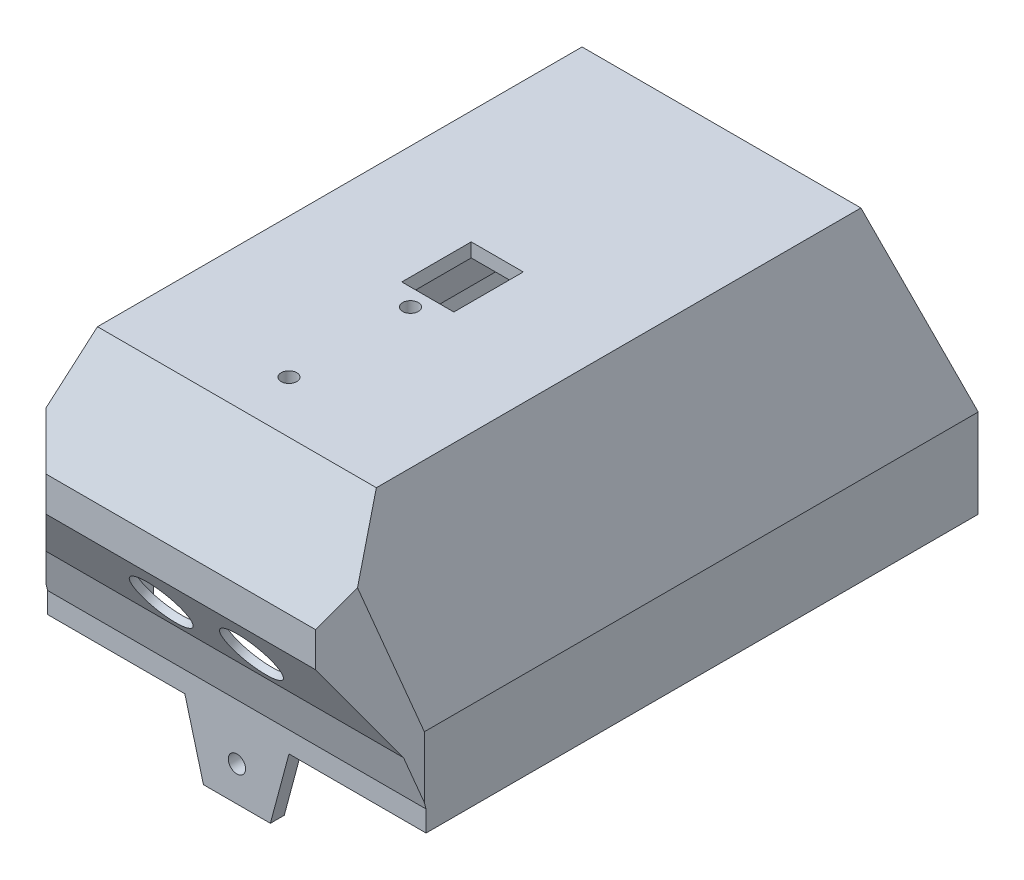
from build123d import *
from OCP.BRepFilletAPI import BRepFilletAPI_MakeChamfer

# Parameters (mm, degrees)
SKETCH1_W                                    = 101
SKETCH1_H                                    = 151
BOX_DEPTH                                    = 75
CHAMFER_SIDES_SIZE                           = 50
CHAMFER_SIDES_SIZE2                          = 13.397459622
CHAMFER_BACK_SIZE                            = 50
CHAMFER_BACK_SIZE2                           = 18.198511713
SHELL1_T                                     = 4
SKETCH2_W                                    = 30
SKETCH2_H                                    = 20
SKETCH2_R                                    = 2.5
FRONT_MOUNT_TAB_DEPTH                        = 4
BACK_START                                   = -4
SKETCH3_W                                    = 30
SKETCH3_H                                    = 20
SKETCH3_R                                    = 2.5
BACK_MOUNT_TAB_DEPTH                         = 4
CHAMFER_MOUNT_TAB_SIZE                       = 20
CHAMFER_MOUNT_TAB_SIZE_2                     = 5.358983849
HEAD_ASSEMBLY_MOUNT_AND_CABLE_PASSTHRU_REACH = 140.172
SKETCH4_R                                    = 2.25
SKETCH4_W                                    = 15
SKETCH4_H                                    = 20
STAIR_DETECTION_MOUNT_DEPTH                  = 30
SHELL_START                                  = -28
SHELL_MOUNT_DEPTH                            = 56
SKETCH7_W                                    = 56
SKETCH7_H                                    = 62
OPEN_SHELL_TO_SHELL_DEPTH                    = 4
FILL_GAP_REACH                               = 187.721
SKETCH9_W                                    = 56
SKETCH9_H                                    = 2
STAIR_DETECTION_EYE_HOLES_REACH              = 183.466
SKETCH8_R                                    = 8.25
CHAMFER_FRONT_1_SIZE                         = 25
CHAMFER_FRONT_2_SIZE                         = 7
POWER_SWITCH_AND_USB_ACCESS_REACH            = 201.736
SKETCH10_W                                   = 25
SKETCH10_H                                   = 15


# Read off the part's stored shape, not the designer's step: shell mount
# Some blends are built 0.0001 mm under size
with BuildPart() as part:
    # Sketch1 → box (new body)
    with BuildSketch(Plane(origin=(0, 0, 0), x_dir=(1, 0, 0), z_dir=(0, 1, 0))):
        Rectangle(SKETCH1_W, SKETCH1_H)
    extrude(amount=BOX_DEPTH)

    # Chamfer sides: one chamfer whose edges measure the first distance from different faces: ONE call of the kernel's chamfer builder (chamfer() names one face for all edges)
    chamfer_sides_edges_1 = [part.edges().sort_by_distance(p)[0] for p in [
        (-50.5, 75, 0),
    ]]
    chamfer_sides_side_1 = [part.faces().sort_by_distance(p)[0] for p in [
        (-50.5, 37.5, 0),
    ]]
    chamfer_sides_edges_2 = [part.edges().sort_by_distance(p)[0] for p in [
        (50.5, 75, 0),
    ]]
    chamfer_sides_side_2 = [part.faces().sort_by_distance(p)[0] for p in [
        (50.5, 37.5, 0),
    ]]
    chamfer_sides = BRepFilletAPI_MakeChamfer(part.part.solid().wrapped)
    for e in chamfer_sides_edges_1:
        chamfer_sides.Add(CHAMFER_SIDES_SIZE, CHAMFER_SIDES_SIZE2, e.wrapped, chamfer_sides_side_1[0].wrapped)  # the first distance lies on this face
    for e in chamfer_sides_edges_2:
        chamfer_sides.Add(CHAMFER_SIDES_SIZE, CHAMFER_SIDES_SIZE2, e.wrapped, chamfer_sides_side_2[0].wrapped)  # the first distance lies on this face
    add(Compound.cast(chamfer_sides.Shape()), mode=Mode.REPLACE)

    # Chamfer back
    chamfer_back_edges = [part.edges().sort_by_distance(p)[0] for p in [
        (0, 75, -75.5),
    ]]
    chamfer_back_side = [part.faces().sort_by_distance(p)[0] for p in [
        (0, 35.478938394, -75.5),
    ]]
    chamfer(chamfer_back_edges, length=CHAMFER_BACK_SIZE, length2=CHAMFER_BACK_SIZE2, reference=chamfer_back_side[0])

    # Shell1
    shell1_openings = [part.faces().sort_by_distance(p)[0] for p in [
        (0, 0, 0),
    ]]
    offset(amount=SHELL1_T, openings=shell1_openings, kind=Kind.INTERSECTION)

    # Sketch2 → front mount tab (add)
    with BuildSketch(Plane.XY.offset(79.5)):
        with Locations((0, -10)):
            Rectangle(SKETCH2_W, SKETCH2_H)
        with Locations((0, -10)):
            Circle(SKETCH2_R, mode=Mode.SUBTRACT)
    extrude(amount=-FRONT_MOUNT_TAB_DEPTH)

    # Sketch3 → back mount tab (add)
    with BuildSketch(Plane(origin=(0, 0, -79.5), x_dir=(-1, 0, 0), z_dir=(0, 0, -1)).offset(BACK_START)):
        with Locations((0, -10)):
            Rectangle(SKETCH3_W, SKETCH3_H)
        with Locations(Location((0, -10, 0), (0, 0, 180))):
            Circle(SKETCH3_R, mode=Mode.SUBTRACT)
    extrude(amount=BACK_MOUNT_TAB_DEPTH)

    # Chamfer mount tab
    chamfer_mount_tab_edges_1 = [part.edges().sort_by_distance(p)[0] for p in [
        (-15, -20, 77.5),
    ]]
    chamfer_mount_tab_side_1 = [part.faces().sort_by_distance(p)[0] for p in [
        (-15, -19.892820323, 77.5),
    ]]
    chamfer_mount_tab_edges_2 = [part.edges().sort_by_distance(p)[0] for p in [
        (15, -20, 77.5),
    ]]
    chamfer_mount_tab_side_2 = [part.faces().sort_by_distance(p)[0] for p in [
        (15, -19.892820323, 77.5),
    ]]
    chamfer_mount_tab_edges_3 = [part.edges().sort_by_distance(p)[0] for p in [
        (-15, -20, -77.5),
    ]]
    chamfer_mount_tab_side_3 = [part.faces().sort_by_distance(p)[0] for p in [
        (-15, -19.892820323, -77.5),
    ]]
    chamfer_mount_tab_edges_4 = [part.edges().sort_by_distance(p)[0] for p in [
        (15, -20, -77.5),
    ]]
    chamfer_mount_tab_side_4 = [part.faces().sort_by_distance(p)[0] for p in [
        (14.892820323, -20, -77.5),
    ]]
    chamfer_mount_tab = BRepFilletAPI_MakeChamfer(part.part.solid().wrapped)
    for e in chamfer_mount_tab_edges_1:
        chamfer_mount_tab.Add(CHAMFER_MOUNT_TAB_SIZE - 0.0001, CHAMFER_MOUNT_TAB_SIZE_2 - 0.0001, e.wrapped, chamfer_mount_tab_side_1[0].wrapped)
    for e in chamfer_mount_tab_edges_2:
        chamfer_mount_tab.Add(CHAMFER_MOUNT_TAB_SIZE - 0.0001, CHAMFER_MOUNT_TAB_SIZE_2 - 0.0001, e.wrapped, chamfer_mount_tab_side_2[0].wrapped)
    for e in chamfer_mount_tab_edges_3:
        chamfer_mount_tab.Add(CHAMFER_MOUNT_TAB_SIZE - 0.0001, CHAMFER_MOUNT_TAB_SIZE_2 - 0.0001, e.wrapped, chamfer_mount_tab_side_3[0].wrapped)
    for e in chamfer_mount_tab_edges_4:
        chamfer_mount_tab.Add(CHAMFER_MOUNT_TAB_SIZE_2 - 0.0001, CHAMFER_MOUNT_TAB_SIZE - 0.0001, e.wrapped, chamfer_mount_tab_side_4[0].wrapped)
    add(Compound.cast(chamfer_mount_tab.Shape()), mode=Mode.REPLACE)  # a hair under: the kernel refuses the full size

    # Sketch4 → head assembly mount and cable passthru (cut, up to next)
    with BuildSketch(Plane(origin=(0, 79, 0), x_dir=(1, 0, 0), z_dir=(0, 1, 0)), mode=Mode.PRIVATE) as head_assembly_mount_and_cable_passthru_sk1:
        with Locations(Location((0, -64.5, 0), (0, 0, 270))):
            Circle(SKETCH4_R)
    head_assembly_mount_and_cable_passthru_tool1 = extrude(head_assembly_mount_and_cable_passthru_sk1.sketch, amount=-HEAD_ASSEMBLY_MOUNT_AND_CABLE_PASSTHRU_REACH, mode=Mode.PRIVATE) & part.part
    # Sketch4 → head assembly mount and cable passthru (cut, up to next)
    with BuildSketch(Plane(origin=(0, 79, 0), x_dir=(1, 0, 0), z_dir=(0, 1, 0)), mode=Mode.PRIVATE) as head_assembly_mount_and_cable_passthru_sk2:
        with Locations(Location((0, -29.5, 0), (0, 0, 270))):
            Circle(SKETCH4_R)
    head_assembly_mount_and_cable_passthru_tool2 = extrude(head_assembly_mount_and_cable_passthru_sk2.sketch, amount=-HEAD_ASSEMBLY_MOUNT_AND_CABLE_PASSTHRU_REACH, mode=Mode.PRIVATE) & part.part
    # Sketch4 → head assembly mount and cable passthru (cut, up to next)
    with BuildSketch(Plane(origin=(0, 79, 0), x_dir=(1, 0, 0), z_dir=(0, 1, 0)), mode=Mode.PRIVATE) as head_assembly_mount_and_cable_passthru_sk3:
        with Locations((0, -14.5)):
            Rectangle(SKETCH4_W, SKETCH4_H)
    head_assembly_mount_and_cable_passthru_tool3 = extrude(head_assembly_mount_and_cable_passthru_sk3.sketch, amount=-HEAD_ASSEMBLY_MOUNT_AND_CABLE_PASSTHRU_REACH, mode=Mode.PRIVATE) & part.part
    add(head_assembly_mount_and_cable_passthru_tool1.solids().sort_by_distance((0, 79, 64.5))[0], mode=Mode.SUBTRACT)
    add(head_assembly_mount_and_cable_passthru_tool2.solids().sort_by_distance((0, 79, 29.5))[0], mode=Mode.SUBTRACT)
    add(head_assembly_mount_and_cable_passthru_tool3.solids().sort_by_distance((0, 79, 14.5))[0], mode=Mode.SUBTRACT)


with BuildPart() as body_2:
    # Sketch5 → stair detection mount (new, symmetric)
    with BuildSketch(Plane(origin=(0, 0, 0), x_dir=(0, 0, -1), z_dir=(1, 0, 0))):
        Polygon((-79.5, 13), (-95.665807537, 41), (-95.665807537, 51), (-79.5, 79), (-75.5, 79), (-75.5, 75), (-75.5, 25), (-75.5, 13), align=None)
    extrude(amount=STAIR_DETECTION_MOUNT_DEPTH, both=True)

    # shell mount outline → shell mount (cut)
    with BuildSketch(Plane.YZ.offset(SHELL_START)):
        Polygon((77, 75.5), (77, 78.345299462), (50.464101615, 93.665807537), (41.535898385, 93.665807537), (15, 78.345299462), (15, 75.5), align=None)
    extrude(amount=SHELL_MOUNT_DEPTH, mode=Mode.SUBTRACT)


with BuildPart() as open_shell_to_shell_tool:
    # Sketch7 → open shell to shell (new body)
    with BuildSketch(Plane.XY.offset(79.5)):
        with Locations((0, 46)):
            Rectangle(SKETCH7_W, SKETCH7_H)
    extrude(amount=-OPEN_SHELL_TO_SHELL_DEPTH)


with BuildPart() as part_1:
    add(part.part)

    # open shell to shell: cut by open_shell_to_shell_tool
    add(open_shell_to_shell_tool.part, mode=Mode.SUBTRACT)

    # Sketch9 → fill gap (add, up to next)
    with BuildSketch(Plane(origin=(0, 0, 79.5), x_dir=(-1, 0, 0), z_dir=(0, 0, -1)), mode=Mode.PRIVATE) as fill_gap_sk1:
        with Locations((0, 76)):
            Rectangle(SKETCH9_W, SKETCH9_H)
    fill_gap_tool1 = extrude(fill_gap_sk1.sketch, amount=FILL_GAP_REACH, mode=Mode.PRIVATE) - part_1.part
    add(fill_gap_tool1.solids().sort_by_distance((0, 76, 79.5))[0])


with BuildPart() as body_2_1:
    add(body_2.part)

    # open shell to shell: cut by open_shell_to_shell_tool
    add(open_shell_to_shell_tool.part, mode=Mode.SUBTRACT)


with BuildPart() as part_2:
    add(part_1.part)

    # Combine two shells: union body 2
    add(body_2_1.part)

    # Sketch8 → stair detection eye holes (cut, up to next)
    with BuildSketch(Plane(origin=(0, -31.1745098, 53.995834875), x_dir=(1, 0, 0), z_dir=(0, -0.4999999999999956, 0.8660254037844412)), mode=Mode.PRIVATE) as stair_detection_eye_holes_sk1:
        with Locations(Location((13, 68.628330249, 0), (0, 0, 270))):
            Circle(SKETCH8_R)
    stair_detection_eye_holes_tool1 = extrude(stair_detection_eye_holes_sk1.sketch, amount=-STAIR_DETECTION_EYE_HOLES_REACH, mode=Mode.PRIVATE) & part_2.part
    # Sketch8 → stair detection eye holes (cut, up to next)
    with BuildSketch(Plane(origin=(0, -31.1745098, 53.995834875), x_dir=(1, 0, 0), z_dir=(0, -0.4999999999999956, 0.8660254037844412)), mode=Mode.PRIVATE) as stair_detection_eye_holes_sk2:
        with Locations(Location((-13, 68.628330249, 0), (0, 0, 90))):
            Circle(SKETCH8_R)
    stair_detection_eye_holes_tool2 = extrude(stair_detection_eye_holes_sk2.sketch, amount=-STAIR_DETECTION_EYE_HOLES_REACH, mode=Mode.PRIVATE) & part_2.part
    add(stair_detection_eye_holes_tool1.solids().sort_by_distance((13, 28.259368, 88.31))[0], mode=Mode.SUBTRACT)
    add(stair_detection_eye_holes_tool2.solids().sort_by_distance((-13, 28.259368, 88.31))[0], mode=Mode.SUBTRACT)

    # Chamfer front 1
    # the kernel refuses this chamfer: 25 mm, written as the material it adds along each edge
    with BuildSketch(Plane(origin=(-30, 79, 79.5), x_dir=(-0.9996219169112966, 0, -0.027495876610586594), z_dir=(0, -1, 0))) as chamfer_front_1_piece_1_section:
        Polygon((CHAMFER_FRONT_1_SIZE * 0.999621916911, -CHAMFER_FRONT_1_SIZE * 0.0274958766106), (-CHAMFER_FRONT_1_SIZE * 0.0274958766106, -CHAMFER_FRONT_1_SIZE * 0.999621916911), (0, 0), align=None)
    chamfer_front_1_piece_1 = extrude(amount=130.292074699, mode=Mode.PRIVATE)
    chamfer_front_1_piece_1 = split(chamfer_front_1_piece_1, bisect_by=Plane(origin=(-54.5, 43.759151697, 84.684492494), z_dir=(1, 0, 0)), keep=Keep.TOP, mode=Mode.PRIVATE)
    chamfer_front_1_piece_1 = split(chamfer_front_1_piece_1, bisect_by=Plane(origin=(-48.880491022, 46.498903009, 84.684492494), z_dir=(0.9659258262890682, -0.25881904510252135, 0)), keep=Keep.TOP, mode=Mode.PRIVATE)
    chamfer_front_1_piece_1 = split(chamfer_front_1_piece_1, bisect_by=Plane(origin=(-38.655599925, 38.314314876, 94.115226508), z_dir=(0, 0.4999999999999953, -0.8660254037844416)), keep=Keep.TOP, mode=Mode.PRIVATE)
    chamfer_front_1_piece_1 = split(chamfer_front_1_piece_1, bisect_by=Plane(origin=(-38.655599925, 50.32441267, 96.055858064), z_dir=(0, -0.4999999999999949, -0.8660254037844416)), keep=Keep.TOP, mode=Mode.PRIVATE)
    chamfer_front_1_piece_1 = split(chamfer_front_1_piece_1, bisect_by=Plane(origin=(-38.655599925, 43.759151697, 95.665807537), z_dir=(0, 0, -1)), keep=Keep.TOP, mode=Mode.PRIVATE)
    add(chamfer_front_1_piece_1)
    with BuildSketch(Plane(origin=(30, 79, 79.5), x_dir=(0.9996219169112966, 0, -0.027495876610586594), z_dir=(0, -1, 0))) as chamfer_front_1_piece_2_section:
        Polygon((CHAMFER_FRONT_1_SIZE * 0.999621916911, CHAMFER_FRONT_1_SIZE * 0.0274958766106), (-CHAMFER_FRONT_1_SIZE * 0.0274958766106, CHAMFER_FRONT_1_SIZE * 0.999621916911), (0, 0), align=None)
    chamfer_front_1_piece_2 = extrude(amount=130.292074699, mode=Mode.PRIVATE)
    chamfer_front_1_piece_2 = split(chamfer_front_1_piece_2, bisect_by=Plane(origin=(38.655599925, 38.314314876, 94.115226508), z_dir=(0, 0.4999999999999953, -0.8660254037844416)), keep=Keep.TOP, mode=Mode.PRIVATE)
    chamfer_front_1_piece_2 = split(chamfer_front_1_piece_2, bisect_by=Plane(origin=(48.880491022, 46.498903009, 84.684492494), z_dir=(-0.9659258262890682, -0.25881904510252135, 0)), keep=Keep.TOP, mode=Mode.PRIVATE)
    chamfer_front_1_piece_2 = split(chamfer_front_1_piece_2, bisect_by=Plane(origin=(54.5, 43.759151697, 84.684492494), z_dir=(-1, 0, 0)), keep=Keep.TOP, mode=Mode.PRIVATE)
    chamfer_front_1_piece_2 = split(chamfer_front_1_piece_2, bisect_by=Plane(origin=(38.655599925, 50.32441267, 96.055858064), z_dir=(0, -0.4999999999999949, -0.8660254037844416)), keep=Keep.TOP, mode=Mode.PRIVATE)
    chamfer_front_1_piece_2 = split(chamfer_front_1_piece_2, bisect_by=Plane(origin=(38.655599925, 43.759151697, 95.665807537), z_dir=(0, 0, -1)), keep=Keep.TOP, mode=Mode.PRIVATE)
    add(chamfer_front_1_piece_2)

    # Chamfer front 2
    chamfer_front_2_edges = [part_2.edges().sort_by_distance(p)[0] for p in [
        (0, 13, 79.5),
    ]]
    chamfer(chamfer_front_2_edges, length=CHAMFER_FRONT_2_SIZE)

    # Sketch10 → power switch and USB access (cut, up to next)
    with BuildSketch(Plane(origin=(0, 0, -79.5), x_dir=(-1, 0, 0), z_dir=(0, 0, -1)), mode=Mode.PRIVATE) as power_switch_and_usb_access_sk1:
        with Locations((-7, 14)):
            Rectangle(SKETCH10_W, SKETCH10_H)
    power_switch_and_usb_access_tool1 = extrude(power_switch_and_usb_access_sk1.sketch, amount=-POWER_SWITCH_AND_USB_ACCESS_REACH, mode=Mode.PRIVATE) & part_2.part
    add(power_switch_and_usb_access_tool1.solids().sort_by_distance((7, 14, -79.5))[0], mode=Mode.SUBTRACT)


solid = part_2.part
